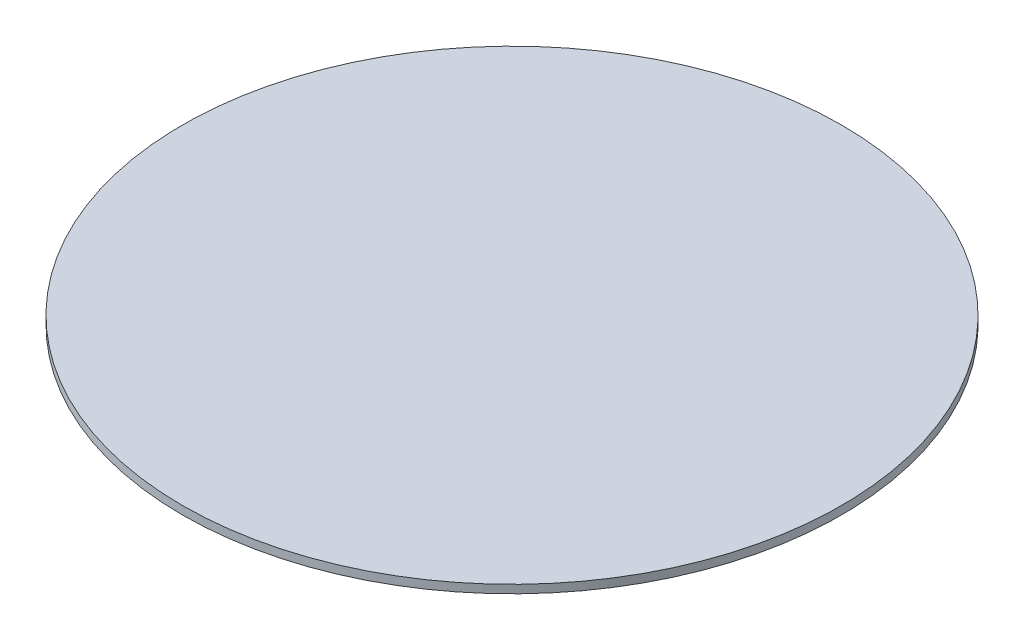
from build123d import *

# Parameters (mm, degrees)
SKETCH1_R           = 120
BOSS_EXTRUDE1_DEPTH = 3


with BuildPart() as part:
    # Sketch1 → Boss-Extrude1 (new body)
    with BuildSketch(Plane(origin=(0, 0, 0), x_dir=(1, 0, 0), z_dir=(0, 1, 0))):
        Circle(SKETCH1_R)
    extrude(amount=BOSS_EXTRUDE1_DEPTH)


solid = part.part
